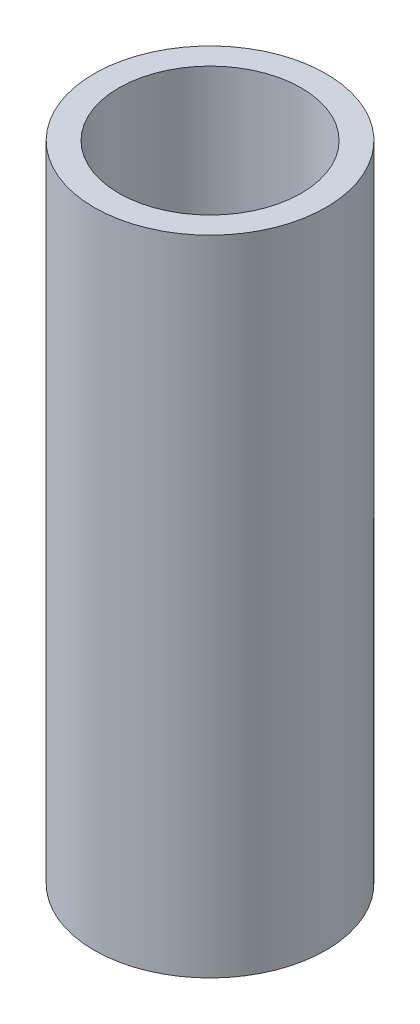
from build123d import *

# Parameters (mm, degrees)
SKETCH1_R           = 5.08
BOSS_EXTRUDE1_DEPTH = 28.194
SKETCH3_R           = 4
CUT_EXTRUDE2_DEPTH  = 30.094921138


with BuildPart() as part:
    # Sketch1 → Boss-Extrude1 (new body)
    with BuildSketch(Plane(origin=(0, 0, 0), x_dir=(1, 0, 0), z_dir=(0, 1, 0))):
        Circle(SKETCH1_R)
    extrude(amount=BOSS_EXTRUDE1_DEPTH)

    # Sketch3 → Cut-Extrude2 (cut, through all)
    with BuildSketch(Plane(origin=(0, 28.194, 0), x_dir=(1, 0, 0), z_dir=(0, 1, 0))):
        Circle(SKETCH3_R)
    extrude(amount=-CUT_EXTRUDE2_DEPTH, mode=Mode.SUBTRACT)


solid = part.part
